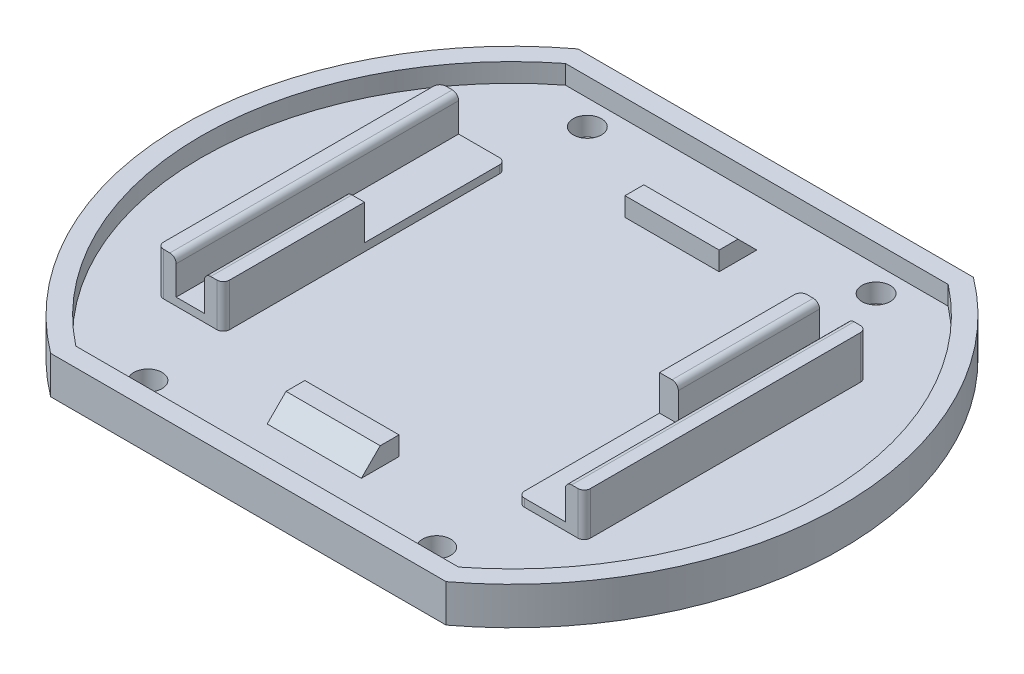
from build123d import *

# Parameters (mm, degrees)
A_BASE_T42_OUTLINE_R               = 2.2479
A_BASE_T42_OUTLINE_R_2             = 1
A_BASE_T42_DEPTH                   = 3
OUTER_BRIM_DEPTH                   = 3
SKETCH5_W                          = 15
SKETCH5_H                          = 3
BASE_SUPPORTS_DEPTH                = 3
BASE_SUPPORTS_CHAMFER_SIZE         = 3
COVER_START                        = -3
SKETCH6_R                          = 1
COVER_DEPTH                        = 3
SKETCH2_W                          = 10.5
SKETCH2_H                          = 45
DYNAMIXEL_OFFSET_DEPTH             = 1.25
SKETCH3_W                          = 3
SKETCH3_H                          = 45
SKETCH3_H_2                        = 22.5
DYNAMIXEL_SIDE_SUPPORT_WALLS_DEPTH = 5.6
DYNAMIXEL_SUPPORT_CONTOURING_R     = 1


# Read off the part's stored shape, not the designer's step: a_base_t42
with BuildPart() as part:
    # a_base_t42 outline → a_base_t42 (new body)
    with BuildSketch(Plane(origin=(0, 0, 0), x_dir=(1, 0, 0), z_dir=(0, 1, 0))):
        with BuildLine():
            ThreePointArc((31.5, -42), (52.5, 0), (31.5, 42))
            Line((31.5, 42), (-31.5, 42))
            ThreePointArc((-31.5, 42), (-52.5, 0), (-31.5, -42))
            Line((-31.5, -42), (31.5, -42))
        make_face()
        with Locations((-23, -35)):
            Circle(A_BASE_T42_OUTLINE_R, mode=Mode.SUBTRACT)
        with Locations((23, -35)):
            Circle(A_BASE_T42_OUTLINE_R, mode=Mode.SUBTRACT)
        with Locations((-40.25, 0)):
            Circle(A_BASE_T42_OUTLINE_R_2, mode=Mode.SUBTRACT)
        with Locations((-23, 35)):
            Circle(A_BASE_T42_OUTLINE_R, mode=Mode.SUBTRACT)
        with Locations((40.25, 0)):
            Circle(A_BASE_T42_OUTLINE_R_2, mode=Mode.SUBTRACT)
        with Locations((23, 35)):
            Circle(A_BASE_T42_OUTLINE_R, mode=Mode.SUBTRACT)
    extrude(amount=A_BASE_T42_DEPTH)

    # Sketch1 → Outer Brim (add)
    with BuildSketch(Plane(origin=(0, 3, 0), x_dir=(1, 0, 0), z_dir=(0, 1, 0))):
        with BuildLine():
            Line((-31.5, -42), (31.5, -42))
            ThreePointArc((31.5, -42), (52.5, 0), (31.5, 42))
            Line((31.5, 42), (-31.5, 42))
            ThreePointArc((-31.5, 42), (-52.5, 0), (-31.5, -42))
        make_face()
        with BuildLine():
            Line((30.483602149, 39), (-30.483602149, 39))
            ThreePointArc((-30.483602149, 39), (-49.5, 0), (-30.483602149, -39))
            Line((-30.483602149, -39), (30.483602149, -39))
            ThreePointArc((30.483602149, -39), (49.5, 0), (30.483602149, 39))
        make_face(mode=Mode.SUBTRACT)
    extrude(amount=OUTER_BRIM_DEPTH)

    # Sketch5 → Base Supports (add)
    with BuildSketch(Plane(origin=(0, 3, 0), x_dir=(1, 0, 0), z_dir=(0, 1, 0))):
        with Locations((0, -27)):
            Rectangle(SKETCH5_W, SKETCH5_H)
        with Locations((0, 27)):
            Rectangle(SKETCH5_W, SKETCH5_H)
    extrude(amount=BASE_SUPPORTS_DEPTH)

    # Base Supports Chamfer
    base_supports_chamfer_edges = [part.edges().sort_by_distance(p)[0] for p in [
        (0, 3, 28.5),
        (0, 3, -28.5),
    ]]
    chamfer(base_supports_chamfer_edges, length=BASE_SUPPORTS_CHAMFER_SIZE - 0.0001)  # a hair under: the kernel refuses the full size

    # Sketch6 → Cover (add)
    with BuildSketch(Plane(origin=(0, 3, 0), x_dir=(1, 0, 0), z_dir=(0, 1, 0)).offset(COVER_START)):
        with Locations((-40.25, 0)):
            Circle(SKETCH6_R)
        with Locations((40.25, 0)):
            Circle(SKETCH6_R)
    extrude(amount=COVER_DEPTH)

    # Sketch2 → Dynamixel Offset (add)
    with BuildSketch(Plane(origin=(0, 3, 0), x_dir=(1, 0, 0), z_dir=(0, 1, 0))):
        with Locations((28.75, 0)):
            Rectangle(SKETCH2_W, SKETCH2_H)
        with Locations((-28.75, 0)):
            Rectangle(SKETCH2_W, SKETCH2_H)
    extrude(amount=DYNAMIXEL_OFFSET_DEPTH)

    # Sketch3 → Dynamixel Side Support Walls (add)
    with BuildSketch(Plane(origin=(0, 4.25, 0), x_dir=(1, 0, 0), z_dir=(0, 1, 0))):
        with Locations((-32.5, 0)):
            Rectangle(SKETCH3_W, SKETCH3_H)
        with Locations((-25, -11.25)):
            Rectangle(SKETCH3_W, SKETCH3_H_2)
        with Locations((25, 11.25)):
            Rectangle(SKETCH3_W, SKETCH3_H_2)
        with Locations((32.5, 0)):
            Rectangle(SKETCH3_W, SKETCH3_H)
    extrude(amount=DYNAMIXEL_SIDE_SUPPORT_WALLS_DEPTH)

    # Dynamixel Support Contouring
    dynamixel_support_contouring_edges = [part.edges().sort_by_distance(p)[0] for p in [
        (34, 6.425, -22.5),
        (23.5, 6.425, -22.5),
        (-23.5, 3.625, -22.5),
        (-34, 6.425, -22.5),
        (-34, 6.425, 22.5),
        (-23.5, 6.425, 22.5),
        (34, 6.425, 22.5),
        (23.5, 3.625, 22.5),
        (31, 9.85, 0),
        (26.5, 9.85, -11.25),
        (-26.5, 9.85, 11.25),
        (-31, 9.85, 0),
    ]]
    fillet(dynamixel_support_contouring_edges, radius=DYNAMIXEL_SUPPORT_CONTOURING_R)


solid = part.part
